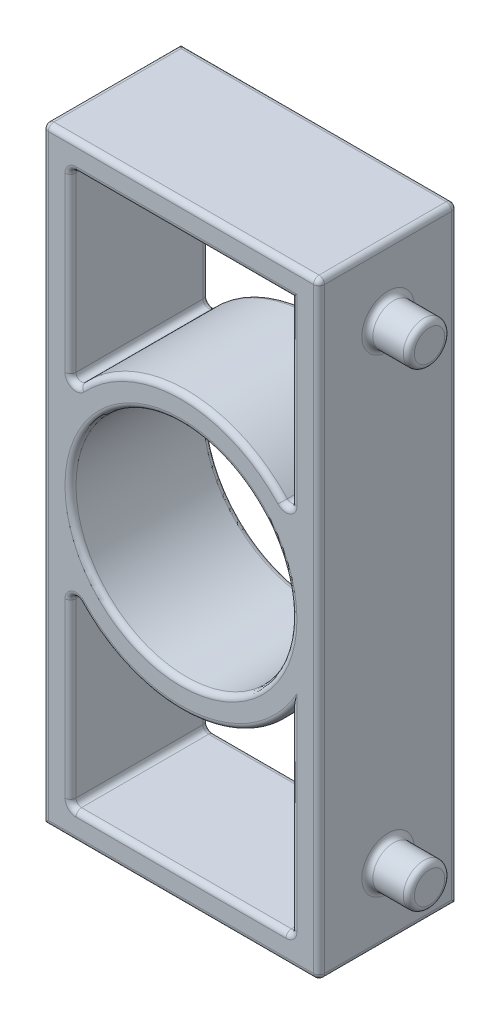
from build123d import *

# Parameters (mm, degrees)
SKETCH1_W           = 50
SKETCH1_H           = 220
BOSS_EXTRUDE1_DEPTH = 50
SKETCH2_R           = 7.5
BOSS_EXTRUDE2_DEPTH = 15
SKETCH3_R           = 40
CUT_EXTRUDE1_DEPTH  = 138.20422734
CUT_EXTRUDE2_DEPTH  = 138.20422734
FILLET1_R           = 2


with BuildPart() as part:
    # Sketch1 → Boss-Extrude1 (new, symmetric)
    with BuildSketch(Plane(origin=(0, 0, 0), x_dir=(0, 0, -1), z_dir=(1, 0, 0))):
        Rectangle(SKETCH1_W, SKETCH1_H)
    extrude(amount=BOSS_EXTRUDE1_DEPTH, both=True)

    # Sketch2 → Boss-Extrude2 (add)
    with BuildSketch(Plane(origin=(50, 0, 0), x_dir=(0, 0, -1), z_dir=(1, 0, 0))):
        with Locations((0, 85)):
            Circle(SKETCH2_R)
        with Locations((0, -85)):
            Circle(SKETCH2_R)
    boss_extrude2 = extrude(amount=BOSS_EXTRUDE2_DEPTH)

    # Mirror1: Boss-Extrude2 across plane
    add(boss_extrude2.mirror(Plane(origin=(0, 0, 0), x_dir=(0, 0, 1), z_dir=(1, 0, 0))))

    # Sketch3 → Cut-Extrude1 (cut, through all)
    with BuildSketch(Plane(origin=(0, 0, -25), x_dir=(-1, 0, 0), z_dir=(0, 0, -1))):
        Circle(SKETCH3_R)
    extrude(amount=-CUT_EXTRUDE1_DEPTH, mode=Mode.SUBTRACT)

    # Sketch4 → Cut-Extrude2 (cut, through all)
    with BuildSketch(Plane(origin=(0, 0, -25), x_dir=(-1, 0, 0), z_dir=(0, 0, -1))):
        with BuildLine():
            Line((-40, -30), (-40, -100))
            Line((-40, -100), (40, -100))
            Line((40, -100), (40, -30))
            ThreePointArc((40, -30), (0, -50), (-40, -30))
        make_face()
        with BuildLine():
            Line((40, 30), (40, 100))
            Line((40, 100), (-40, 100))
            Line((-40, 100), (-40, 30))
            ThreePointArc((-40, 30), (0, 50), (40, 30))
        make_face()
    extrude(amount=-CUT_EXTRUDE2_DEPTH, mode=Mode.SUBTRACT)

    # Fillet1
    fillet1_edges = [part.edges().sort_by_distance(p)[0] for p in [
        (40, -65, -25),
        (0, -50, -25),
        (40, 65, -25),
        (0, 100, -25),
        (0, -100, -25),
        (-40, -65, -25),
        (0, -50, 25),
        (40, -65, 25),
        (0, -100, 25),
        (-40, -65, 25),
        (40, -100, 0),
        (-40, -100, 0),
        (-40, -30, 0),
        (0, 50, -25),
        (-40, 65, -25),
        (0, 50, 25),
        (-40, 65, 25),
        (0, 100, 25),
        (40, 65, 25),
        (-40, 30, 0),
        (-40, 100, 0),
        (40, 30, 0),
        (40, 0, -25),
        (40, 0, 25),
        (-50, -85, 7.5),
        (-65, -85, 7.5),
        (-50, 85, 7.5),
        (-65, 85, 7.5),
        (50, -85, 7.5),
        (65, -85, 7.5),
        (50, 85, 7.5),
        (65, 85, 7.5),
        (-50, 0, 25),
        (-50, 110, 0),
        (50, 0, 25),
        (50, -110, 0),
        (50, 0, -25),
        (50, 110, 0),
        (0, 110, 25),
        (0, 110, -25),
        (0, -110, 25),
    ]]
    fillet(fillet1_edges, radius=FILLET1_R)


solid = part.part
